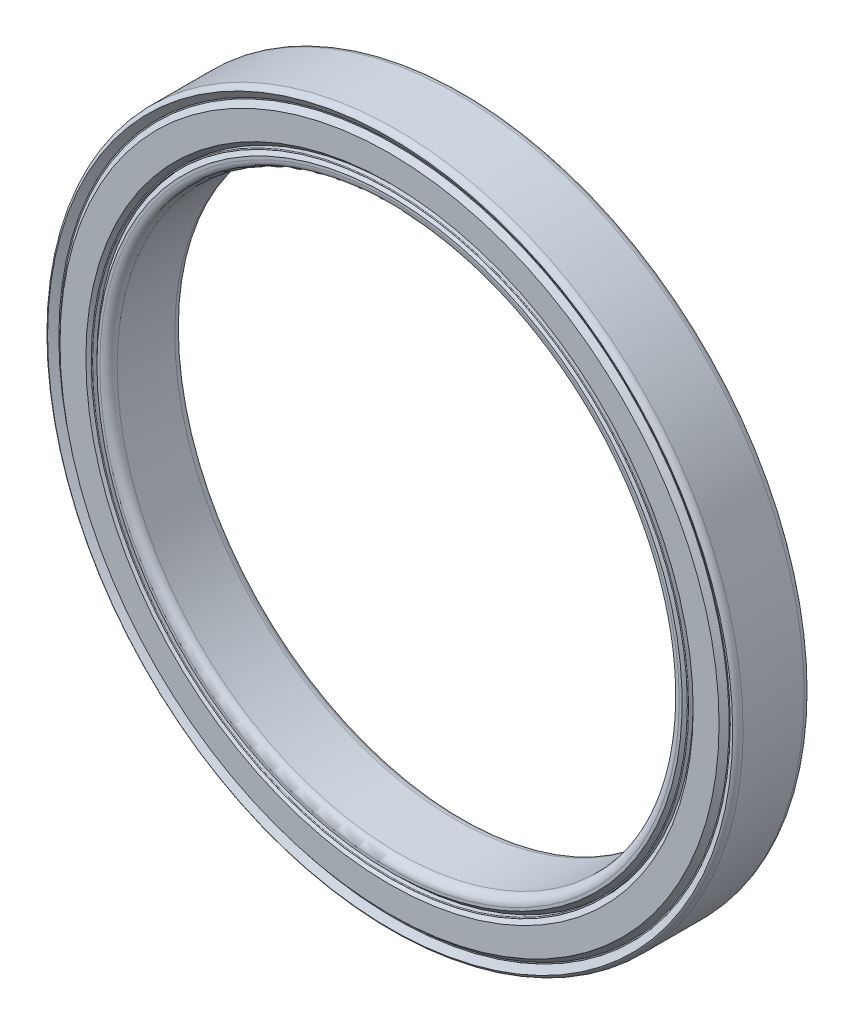
from build123d import *

# Parameters (mm, degrees)
SKETCH3_W         = 4
SKETCH3_H         = 0.583333333
SKETCH3_H_2       = 0.875
SKETCH4_R         = 1.225
CIRPATTERN1_COUNT = 27
FILLET1_R         = 0.37
FILLET2_R         = 0.4625
CHAMFER2_SIZE     = 0.259


with BuildPart() as part:
    # Sketch3 → Revolve1 (revolve)
    with BuildSketch(Plane(origin=(0, 0, 0), x_dir=(0, 0, -1), z_dir=(1, 0, 0)), mode=Mode.PRIVATE) as revolve1_sk:
        with Locations((0, -18.208333334)):
            Rectangle(SKETCH3_W, SKETCH3_H)
        with Locations((0, -15.4375)):
            Rectangle(SKETCH3_W, SKETCH3_H_2)
    revolve(revolve1_sk.sketch.rotate(Axis((0, 0, -2), (0, 0, 1)), 270), axis=Axis((0, 0, -2), (0, 0, 1)))

    # Sketch4 → Cut-Revolve1 (revolve, cut)
    with BuildSketch(Plane(origin=(0, 0, 0), x_dir=(0, 0, -1), z_dir=(1, 0, 0)), mode=Mode.PRIVATE) as cut_revolve1_sk:
        with Locations((0, -16.895833333)):
            Circle(SKETCH4_R)
    revolve(cut_revolve1_sk.sketch.rotate(Axis((0, 0, -2), (0, 0, 1)), 270), axis=Axis((0, 0, -2), (0, 0, 1)), mode=Mode.SUBTRACT)

    # Fillet1
    fillet1_edges = [part.edges().sort_by_distance(p)[0] for p in [
        (18.5, 0, -2),
        (18.5, 0, 2),
    ]]
    fillet(fillet1_edges, radius=FILLET1_R)

    # Fillet2
    fillet2_edges = [part.edges().sort_by_distance(p)[0] for p in [
        (15, 0, -2),
        (15, 0, 2),
    ]]
    fillet(fillet2_edges, radius=FILLET2_R)

    # Chamfer1: read off the stored shape, not the designer's step
    # Chamfer1 outline → Chamfer1 (revolve, cut)
    with BuildSketch(Plane.XZ):
        Polygon((17.916666667, -1.731170922), (17.916666667, -2), (18.282222222, -2), (18.282222222, -1.967236408), align=None)
        Polygon((17.916666667, 1.731170922), (18.282222222, 1.967236408), (18.282222222, 2), (17.916666667, 2), align=None)
    revolve(axis=Axis((0, 0, 0), (0, 0, 1)), mode=Mode.SUBTRACT)

    # Chamfer2
    chamfer2_edges = [part.edges().sort_by_distance(p)[0] for p in [
        (15.875, 0, 2),
        (15.875, 0, -2),
    ]]
    chamfer(chamfer2_edges, length=CHAMFER2_SIZE)


with BuildPart() as body_2:
    # Sketch5 → Revolve2 (revolve)
    with BuildSketch(Plane(origin=(0, 0, 0), x_dir=(0, 0, -1), z_dir=(1, 0, 0))):
        with BuildLine():
            Line((0, -15.670833333), (0, -18.120833333))
            ThreePointArc((0, -18.120833333), (1.225, -16.895833333), (0, -15.670833333))
        make_face()
    revolve(axis=Axis((0, -15.670833333, 0), (0, -1, 0)))


with BuildPart() as cirpattern1_1:
    # CirPattern1: pattern copy
    add(body_2.part.rotate(Axis((0, 0, 0), (0, 0, 1)), 1 * 360 / CIRPATTERN1_COUNT))


with BuildPart() as cirpattern1_2:
    # CirPattern1: pattern copy
    add(body_2.part.rotate(Axis((0, 0, 0), (0, 0, 1)), 2 * 360 / CIRPATTERN1_COUNT))


with BuildPart() as cirpattern1_3:
    # CirPattern1: pattern copy
    add(body_2.part.rotate(Axis((0, 0, 0), (0, 0, 1)), 3 * 360 / CIRPATTERN1_COUNT))


with BuildPart() as cirpattern1_4:
    # CirPattern1: pattern copy
    add(body_2.part.rotate(Axis((0, 0, 0), (0, 0, 1)), 4 * 360 / CIRPATTERN1_COUNT))


with BuildPart() as cirpattern1_5:
    # CirPattern1: pattern copy
    add(body_2.part.rotate(Axis((0, 0, 0), (0, 0, 1)), 5 * 360 / CIRPATTERN1_COUNT))


with BuildPart() as cirpattern1_6:
    # CirPattern1: pattern copy
    add(body_2.part.rotate(Axis((0, 0, 0), (0, 0, 1)), 6 * 360 / CIRPATTERN1_COUNT))


with BuildPart() as cirpattern1_7:
    # CirPattern1: pattern copy
    add(body_2.part.rotate(Axis((0, 0, 0), (0, 0, 1)), 7 * 360 / CIRPATTERN1_COUNT))


with BuildPart() as cirpattern1_8:
    # CirPattern1: pattern copy
    add(body_2.part.rotate(Axis((0, 0, 0), (0, 0, 1)), 8 * 360 / CIRPATTERN1_COUNT))


with BuildPart() as cirpattern1_9:
    # CirPattern1: pattern copy
    add(body_2.part.rotate(Axis((0, 0, 0), (0, 0, 1)), 9 * 360 / CIRPATTERN1_COUNT))


with BuildPart() as cirpattern1_10:
    # CirPattern1: pattern copy
    add(body_2.part.rotate(Axis((0, 0, 0), (0, 0, 1)), 10 * 360 / CIRPATTERN1_COUNT))


with BuildPart() as cirpattern1_11:
    # CirPattern1: pattern copy
    add(body_2.part.rotate(Axis((0, 0, 0), (0, 0, 1)), 11 * 360 / CIRPATTERN1_COUNT))


with BuildPart() as cirpattern1_12:
    # CirPattern1: pattern copy
    add(body_2.part.rotate(Axis((0, 0, 0), (0, 0, 1)), 12 * 360 / CIRPATTERN1_COUNT))


with BuildPart() as cirpattern1_13:
    # CirPattern1: pattern copy
    add(body_2.part.rotate(Axis((0, 0, 0), (0, 0, 1)), 13 * 360 / CIRPATTERN1_COUNT))


with BuildPart() as cirpattern1_14:
    # CirPattern1: pattern copy
    add(body_2.part.rotate(Axis((0, 0, 0), (0, 0, 1)), 14 * 360 / CIRPATTERN1_COUNT))


with BuildPart() as cirpattern1_15:
    # CirPattern1: pattern copy
    add(body_2.part.rotate(Axis((0, 0, 0), (0, 0, 1)), 15 * 360 / CIRPATTERN1_COUNT))


with BuildPart() as cirpattern1_16:
    # CirPattern1: pattern copy
    add(body_2.part.rotate(Axis((0, 0, 0), (0, 0, 1)), 16 * 360 / CIRPATTERN1_COUNT))


with BuildPart() as cirpattern1_17:
    # CirPattern1: pattern copy
    add(body_2.part.rotate(Axis((0, 0, 0), (0, 0, 1)), 17 * 360 / CIRPATTERN1_COUNT))


with BuildPart() as cirpattern1_18:
    # CirPattern1: pattern copy
    add(body_2.part.rotate(Axis((0, 0, 0), (0, 0, 1)), 18 * 360 / CIRPATTERN1_COUNT))


with BuildPart() as cirpattern1_19:
    # CirPattern1: pattern copy
    add(body_2.part.rotate(Axis((0, 0, 0), (0, 0, 1)), 19 * 360 / CIRPATTERN1_COUNT))


with BuildPart() as cirpattern1_20:
    # CirPattern1: pattern copy
    add(body_2.part.rotate(Axis((0, 0, 0), (0, 0, 1)), 20 * 360 / CIRPATTERN1_COUNT))


with BuildPart() as cirpattern1_21:
    # CirPattern1: pattern copy
    add(body_2.part.rotate(Axis((0, 0, 0), (0, 0, 1)), 21 * 360 / CIRPATTERN1_COUNT))


with BuildPart() as cirpattern1_22:
    # CirPattern1: pattern copy
    add(body_2.part.rotate(Axis((0, 0, 0), (0, 0, 1)), 22 * 360 / CIRPATTERN1_COUNT))


with BuildPart() as cirpattern1_23:
    # CirPattern1: pattern copy
    add(body_2.part.rotate(Axis((0, 0, 0), (0, 0, 1)), 23 * 360 / CIRPATTERN1_COUNT))


with BuildPart() as cirpattern1_24:
    # CirPattern1: pattern copy
    add(body_2.part.rotate(Axis((0, 0, 0), (0, 0, 1)), 24 * 360 / CIRPATTERN1_COUNT))


with BuildPart() as cirpattern1_25:
    # CirPattern1: pattern copy
    add(body_2.part.rotate(Axis((0, 0, 0), (0, 0, 1)), 25 * 360 / CIRPATTERN1_COUNT))


with BuildPart() as cirpattern1_26:
    # CirPattern1: pattern copy
    add(body_2.part.rotate(Axis((0, 0, 0), (0, 0, 1)), 26 * 360 / CIRPATTERN1_COUNT))


with BuildPart() as body_29:
    # Sketch6 → Revolve3 (revolve)
    with BuildSketch(Plane(origin=(0, 0, 0), x_dir=(0, 0, -1), z_dir=(1, 0, 0)), mode=Mode.PRIVATE) as revolve3_sk:
        Polygon((-2, -16.205079078), (-2, -17.586587589), (-1.731170922, -17.855416667), (-1.731170922, -17.916666667), (-1.225, -17.916666667), (-1.225, -15.875), (-1.731170922, -15.875), (-1.731170922, -15.93625), align=None)
        Polygon((1.731170922, -17.916666667), (1.225, -17.916666667), (1.225, -15.875), (1.731170922, -15.875), (1.731170922, -15.93625), (2, -16.205079078), (2, -17.586587589), (1.731170922, -17.855416667), align=None)
    revolve(revolve3_sk.sketch.rotate(Axis((0, 0, -2), (0, 0, 1)), 270), axis=Axis((0, 0, -2), (0, 0, 1)))


with BuildPart() as body_30:
    # Sketch7 → Revolve4 (revolve)
    with BuildSketch(Plane(origin=(0, 0, 0), x_dir=(0, 0, -1), z_dir=(1, 0, 0)), mode=Mode.PRIVATE) as revolve4_sk:
        with BuildLine():
            Line((-1.731170922, -15.93625), (-1.731170922, -15.875))
            Line((-1.731170922, -15.875), (-1.969375, -15.875))
            ThreePointArc((-1.969375, -15.875), (-2, -15.905625), (-1.969375, -15.93625))
            Line((-1.969375, -15.93625), (-1.731170922, -15.93625))
        make_face()
        with BuildLine():
            Line((1.731170922, -15.875), (1.969375, -15.875))
            ThreePointArc((1.969375, -15.875), (2, -15.905625), (1.969375, -15.93625))
            Line((1.969375, -15.93625), (1.731170922, -15.93625))
            Line((1.731170922, -15.93625), (1.731170922, -15.875))
        make_face()
    revolve(revolve4_sk.sketch.rotate(Axis((0, 0, -2), (0, 0, 1)), 270), axis=Axis((0, 0, -2), (0, 0, 1)))


solid = Compound([part.part, body_2.part, cirpattern1_1.part, cirpattern1_2.part, cirpattern1_3.part, cirpattern1_4.part, cirpattern1_5.part, cirpattern1_6.part, cirpattern1_7.part, cirpattern1_8.part, cirpattern1_9.part, cirpattern1_10.part, cirpattern1_11.part, cirpattern1_12.part, cirpattern1_13.part, cirpattern1_14.part, cirpattern1_15.part, cirpattern1_16.part, cirpattern1_17.part, cirpattern1_18.part, cirpattern1_19.part, cirpattern1_20.part, cirpattern1_21.part, cirpattern1_22.part, cirpattern1_23.part, cirpattern1_24.part, cirpattern1_25.part, cirpattern1_26.part, body_29.part, body_30.part])
